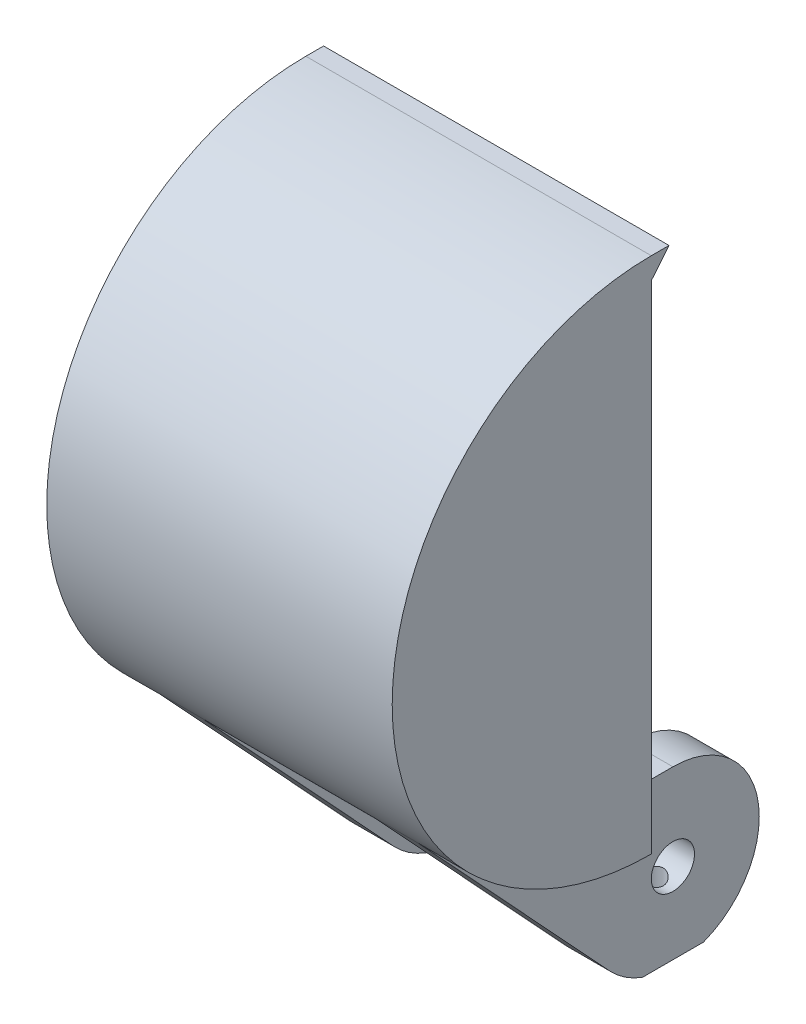
from build123d import *

# Parameters (mm, degrees)
BOSS_EXTRUDE1_DEPTH                 = 25.4
SHELL1_T                            = -3.175
SKETCH4_R                           = 12.7
BOSS_EXTRUDE3_DEPTH                 = 19.05
BOSS_EXTRUDE4_DEPTH                 = 19.05
SKETCH6_R                           = 12.7
CUT_EXTRUDE2_DEPTH                  = 12.7
CUT_EXTRUDE3_START                  = 12.7
SKETCH6_2_R                         = 12.7
CUT_EXTRUDE3_DEPTH                  = 12.7
CUT_EXTRUDE4_REACH                  = 98.093
SKETCH7_R                           = 3.175
BOSS_EXTRUDE5_REACH                 = 98.093
CUT_EXTRUDE5_DEPTH                  = 12.7
BOSS_EXTRUDE6_DEPTH                 = 25.4
FILLET2_R                           = 12.7
CUT_EXTRUDE6_REACH                  = 109.812
CUT_EXTRUDE6_END_RADIUS             = 3.175
SKETCH12_R                          = 1.7526
CUT_EXTRUDE6_DIRECTION_2_REACH      = 109.812
CUT_EXTRUDE6_DIRECTION_2_END_RADIUS = 12.7
CUT_EXTRUDE7_DEPTH                  = 108.812149615


with BuildPart() as part:
    # Sketch2 → Boss-Extrude1 (new, symmetric)
    with BuildSketch(Plane(origin=(0, 0, 0), x_dir=(0, 0, -1), z_dir=(1, 0, 0))):
        with BuildLine():
            Line((0, 0), (0, 76.2))
            ThreePointArc((0, 76.2), (-38.1, 38.1), (0, 0))
        make_face()
    extrude(amount=BOSS_EXTRUDE1_DEPTH, both=True)

    # Shell1
    shell1_openings = [part.faces().sort_by_distance(p)[0] for p in [
        (0, 38.1, 0),
    ]]
    offset(amount=SHELL1_T, openings=shell1_openings)



with BuildPart() as body_2:
    # Sketch4 → Boss-Extrude3 (new, symmetric)
    with BuildSketch(Plane(origin=(0, 0, 0), x_dir=(0, 0, -1), z_dir=(1, 0, 0))):
        with Locations(Location((9.525, -9.525, 0), (0, 0, 180))):
            Circle(SKETCH4_R)
    extrude(amount=BOSS_EXTRUDE3_DEPTH, both=True)


with BuildPart() as part_1:
    add(part.part)

    add(body_2.part)  # Boss-Extrude4 merges body 2
    # Sketch5 → Boss-Extrude4 (add, symmetric)
    with BuildSketch(Plane(origin=(0, 0, 0), x_dir=(0, 0, -1), z_dir=(1, 0, 0))):
        with BuildLine():
            Line((0, 3.175), (0, 0))
            Line((0, 0), (1.124739587, 0))
            ThreePointArc((1.124739587, 0), (5.034871939, 2.354762203), (9.525, 3.175))
            Line((9.525, 3.175), (0, 3.175))
        make_face()
    extrude(amount=BOSS_EXTRUDE4_DEPTH, both=True)

    # Sketch6 → Cut-Extrude2 (cut)
    with BuildSketch(Plane(origin=(0, 0, 0), x_dir=(0, 0, -1), z_dir=(1, 0, 0))):
        with Locations((9.525, -9.525)):
            Circle(SKETCH6_R)
    extrude(amount=-CUT_EXTRUDE2_DEPTH, mode=Mode.SUBTRACT)

    # Sketch6<2> → Cut-Extrude3 (cut)
    with BuildSketch(Plane(origin=(0, 0, 0), x_dir=(0, 0, -1), z_dir=(1, 0, 0)).offset(CUT_EXTRUDE3_START)):
        with Locations((9.525, -9.525)):
            Circle(SKETCH6_2_R)
    extrude(amount=-CUT_EXTRUDE3_DEPTH, mode=Mode.SUBTRACT)

    # Cut-Extrude4: up to this face of the body (flat: up to its plane)
    cut_extrude4_end = Plane(part_1.part.faces().sort_by_distance((25.4, 38.1, 16.170142218))[0])
    # Sketch7 → Cut-Extrude4 (cut, up to the picked face)
    with BuildSketch(Plane.ZY.offset(19.05), mode=Mode.PRIVATE) as cut_extrude4_sk1:
        with Locations(Location((-9.525, -9.525, 0), (0, 0, 180))):
            Circle(SKETCH7_R)
    cut_extrude4_tool1 = split(extrude(cut_extrude4_sk1.sketch, amount=-CUT_EXTRUDE4_REACH, mode=Mode.PRIVATE), bisect_by=cut_extrude4_end, keep=Keep.BOTH, mode=Mode.PRIVATE)
    add(cut_extrude4_tool1.solids().sort_by(Axis((-19.05, -9.525, -9.525), (1, 0, 0)))[0], mode=Mode.SUBTRACT)

    # Boss-Extrude5: up to this face of the body (flat: up to its plane)
    boss_extrude5_end = Plane(part_1.part.faces().sort_by_distance((-19.05, 2.815789755, -4.7625))[0])
    # Sketch8 → Boss-Extrude5 (add, up to the picked face)
    with BuildSketch(Plane(origin=(19.05, 0, 0), x_dir=(0, 0, -1), z_dir=(1, 0, 0)), mode=Mode.PRIVATE) as boss_extrude5_sk1:
        with BuildLine():
            Line((-27.936104056, 12.192779189), (0.212965315, -18.16074027))
            Line((0.212965315, -18.16074027), (5.034871939, -21.404762203))
            Line((5.034871939, -21.404762203), (1.124739587, 0))
            Line((1.124739587, 0), (0, 3.175))
            ThreePointArc((0, 3.175), (-13.704863106, 5.9762961), (-25.211222013, 13.9308066))
            Line((-25.211222013, 13.9308066), (-27.936104056, 12.192779189))
        make_face()
    boss_extrude5_tool1 = split(extrude(boss_extrude5_sk1.sketch, amount=-BOSS_EXTRUDE5_REACH, mode=Mode.PRIVATE), bisect_by=boss_extrude5_end, keep=Keep.BOTH, mode=Mode.PRIVATE)
    add(boss_extrude5_tool1.solids().sort_by(Axis((19.05, -2.840531, 7.724646), (-1, 0, 0)))[0])

    # Sketch9 → Cut-Extrude5 (cut, symmetric)
    with BuildSketch(Plane(origin=(0, 0, 0), x_dir=(0, 0, -1), z_dir=(1, 0, 0))):
        with BuildLine():
            Line((0, 3.175), (0, 0))
            ThreePointArc((0, 0), (-15.240486985, 3.180985746), (-27.936104056, 12.192779189))
            Line((-27.936104056, 12.192779189), (0.212965315, -18.16074027))
            ThreePointArc((0.212965315, -18.16074027), (21.164671418, -14.605162328), (9.525, 3.175))
            Line((9.525, 3.175), (0, 3.175))
        make_face()
    extrude(amount=CUT_EXTRUDE5_DEPTH, both=True, mode=Mode.SUBTRACT)

    # Sketch11 → Boss-Extrude6 (add, symmetric)
    with BuildSketch(Plane(origin=(0, 0, 0), x_dir=(0, 0, -1), z_dir=(1, 0, 0))):
        Polygon((2.609832197, 76.2), (0, 76.2), (0, 73.025), align=None)
    extrude(amount=BOSS_EXTRUDE6_DEPTH, both=True)

    # Fillet2
    # the kernel refuses this fillet: 12.7 mm, written as the material it adds along each edge
    with BuildSketch(Plane(origin=(-22.225, 38.1, 0), x_dir=(0, 1, 0), z_dir=(0, 0, -1))) as fillet2_piece_1:
        with BuildLine():
            CenterArc((34.925 - FILLET2_R, FILLET2_R), FILLET2_R, 270, 90)
            Line((34.925 - FILLET2_R, 0), (34.925, 0))
            Line((34.925, 0), (34.925, FILLET2_R))
        make_face()
    revolve(axis=Axis((-22.225, 38.1, 0), (1, 0, 0)), revolution_arc=180)
    with BuildSketch(Plane(origin=(22.225, 38.1, 0), x_dir=(0, 1, 0), z_dir=(0, 0, -1))) as fillet2_piece_2:
        with BuildLine():
            CenterArc((34.925 - FILLET2_R, -FILLET2_R), FILLET2_R, 0, 90)
            Line((34.925 - FILLET2_R, 0), (34.925, 0))
            Line((34.925, 0), (34.925, -FILLET2_R))
        make_face()
    revolve(axis=Axis((22.225, 38.1, 0), (1, 0, 0)), revolution_arc=180)

    # Cut-Extrude6: up to this cylinder (the profile starts outside it)
    cut_extrude6_end = Plane(origin=(0, -9.525, -9.525), z_dir=(-1, 0, 0)) * Cylinder(CUT_EXTRUDE6_END_RADIUS, 258.724, mode=Mode.PRIVATE)
    # Sketch12 → Cut-Extrude6 (cut, up to the surface)
    with BuildSketch(Plane(origin=(0, -21.404762203, 0), x_dir=(1, 0, 0), z_dir=(0, 1, 0)), mode=Mode.PRIVATE) as cut_extrude6_sk1:
        with Locations(Location((15.875, 9.525, 0), (0, 0, 90))):
            Circle(SKETCH12_R)
    cut_extrude6_tool1 = extrude(cut_extrude6_sk1.sketch, amount=CUT_EXTRUDE6_REACH, mode=Mode.PRIVATE) - cut_extrude6_end
    add(cut_extrude6_tool1.solids().sort_by_distance((15.875, -21.404762, -9.525))[0], mode=Mode.SUBTRACT)
    # Sketch12 → Cut-Extrude6 (cut, up to the surface)
    with BuildSketch(Plane(origin=(0, -21.404762203, 0), x_dir=(1, 0, 0), z_dir=(0, 1, 0)), mode=Mode.PRIVATE) as cut_extrude6_sk2:
        with Locations(Location((-15.875, 9.525, 0), (0, 0, 90))):
            Circle(SKETCH12_R)
    cut_extrude6_tool2 = extrude(cut_extrude6_sk2.sketch, amount=CUT_EXTRUDE6_REACH, mode=Mode.PRIVATE) - cut_extrude6_end
    add(cut_extrude6_tool2.solids().sort_by_distance((-15.875, -21.404762, -9.525))[0], mode=Mode.SUBTRACT)

    # Cut-Extrude6 direction 2: up to this cylinder (the profile starts inside it)
    cut_extrude6_direction_2_end = Plane(origin=(0, -9.525, -9.525), z_dir=(-1, 0, 0)) * Cylinder(CUT_EXTRUDE6_DIRECTION_2_END_RADIUS, 277.774, mode=Mode.PRIVATE)
    # Sketch12 → Cut-Extrude6 direction 2 (cut, up to the surface)
    with BuildSketch(Plane(origin=(0, -21.404762203, 0), x_dir=(1, 0, 0), z_dir=(0, 1, 0)), mode=Mode.PRIVATE) as cut_extrude6_direction_2_sk1:
        with Locations(Location((15.875, 9.525, 0), (0, 0, 90))):
            Circle(SKETCH12_R)
    cut_extrude6_direction_2_tool1 = extrude(cut_extrude6_direction_2_sk1.sketch, amount=-CUT_EXTRUDE6_DIRECTION_2_REACH, mode=Mode.PRIVATE) & cut_extrude6_direction_2_end
    add(cut_extrude6_direction_2_tool1.solids().sort_by_distance((15.875, -21.404762, -9.525))[0], mode=Mode.SUBTRACT)
    # Sketch12 → Cut-Extrude6 direction 2 (cut, up to the surface)
    with BuildSketch(Plane(origin=(0, -21.404762203, 0), x_dir=(1, 0, 0), z_dir=(0, 1, 0)), mode=Mode.PRIVATE) as cut_extrude6_direction_2_sk2:
        with Locations(Location((-15.875, 9.525, 0), (0, 0, 90))):
            Circle(SKETCH12_R)
    cut_extrude6_direction_2_tool2 = extrude(cut_extrude6_direction_2_sk2.sketch, amount=-CUT_EXTRUDE6_DIRECTION_2_REACH, mode=Mode.PRIVATE) & cut_extrude6_direction_2_end
    add(cut_extrude6_direction_2_tool2.solids().sort_by_distance((-15.875, -21.404762, -9.525))[0], mode=Mode.SUBTRACT)

    # Sketch13 → Cut-Extrude7 (cut, through all)
    with BuildSketch(Plane(origin=(0, -21.404762203, 0), x_dir=(1, 0, 0), z_dir=(0, 1, 0))):
        Polygon((19.05, 15.875), (12.7, 15.875), (12.7, 10.397684257), (12.7, 3.175), (19.05, 3.175), align=None)
        Polygon((-19.05, 15.875), (-12.7, 15.875), (-12.7, 10.397684257), (-12.7, 3.175), (-19.05, 3.175), align=None)
    extrude(amount=-CUT_EXTRUDE7_DEPTH, mode=Mode.SUBTRACT)


solid = part_1.part
